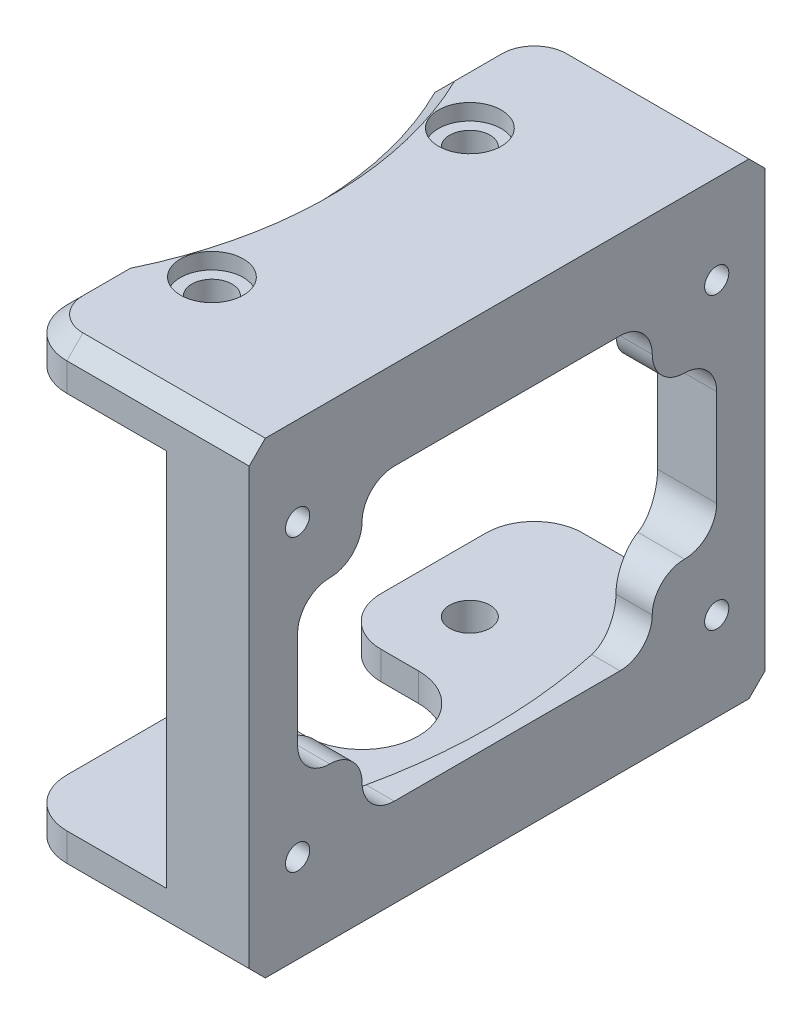
from build123d import *

# Parameters (mm, degrees)
SKETCH_1_W          = 14.314561435
SKETCH_1_H          = 32
SKETCH_1_R          = 1.25
EXTRUDE_1_DEPTH     = 14.5
SKETCH_2_R          = 33
CUT_EXTRUDE_1_DEPTH = 11.75
SKETCH_3_R          = 0.75
CUT_EXTRUDE_2_DEPTH = 26.906691589
CUT_EXTRUDE_3_REACH = 49.466
SKETCH_4_R          = 3.5
CUT_EXTRUDE_5_REACH = 49.466
SKETCH_6_R          = 22
FILLET_1_R          = 3
FILLET_3_R          = 2
CHAMFER_2_SIZE      = 1
SKETCH_5_R          = 1.95
CUT_EXTRUDE_4_DEPTH = 1


with BuildPart() as part:
    # Эскиз1 → Бобышка-Вытянуть1 (new, symmetric)
    with BuildSketch(Plane(origin=(0, 0, 0), x_dir=(1, 0, 0), z_dir=(0, 1, 0))):
        with Locations((26.842719282, 0)):
            Rectangle(SKETCH_1_W, SKETCH_1_H)
        with Locations(Location((23.685438565, 8, 0), (0, 0, 90))):
            Circle(SKETCH_1_R, mode=Mode.SUBTRACT)
        with Locations(Location((23.685438565, -8, 0), (0, 0, 90))):
            Circle(SKETCH_1_R, mode=Mode.SUBTRACT)
    extrude(amount=EXTRUDE_1_DEPTH, both=True)

    # Эскиз2 → Вырез-Вытянуть1 (cut, symmetric)
    with BuildSketch(Plane(origin=(0, 0, 0), x_dir=(1, 0, 0), z_dir=(0, 1, 0))):
        Circle(SKETCH_2_R)
    extrude(amount=CUT_EXTRUDE_1_DEPTH, both=True, mode=Mode.SUBTRACT)

    # Эскиз3 → Вырез-Вытянуть2 (cut, through all)
    with BuildSketch(Plane(origin=(34, 0, 0), x_dir=(0, 0, -1), z_dir=(1, 0, 0))):
        with Locations((-13, 9)):
            Circle(SKETCH_3_R)
        with Locations((-13, -9)):
            Circle(SKETCH_3_R)
        with Locations((13, 9)):
            Circle(SKETCH_3_R)
        with Locations((13, -9)):
            Circle(SKETCH_3_R)
        Polygon((-13, 5), (-9, 5), (-9, 9), (9, 9), (9, 5), (13, 5), (13, -5), (9, -5), (9, -9), (-9, -9), (-9, -5), (-13, -5), align=None)
    extrude(amount=-CUT_EXTRUDE_2_DEPTH, mode=Mode.SUBTRACT)

    # Эскиз4 → Вырез-Вытянуть3 (cut, up to next)
    with BuildSketch(Plane.XZ.offset(14.5), mode=Mode.PRIVATE) as cut_extrude_3_sk1:
        with BuildLine():
            ThreePointArc((25, -3.5), (21.5, 0), (25, 3.5))
            Line((25, 3.5), (19.685438565, 3.5))
            Line((19.685438565, 3.5), (19.685438565, -3.5))
            Line((19.685438565, -3.5), (25, -3.5))
        make_face()
    cut_extrude_3_tool1 = extrude(cut_extrude_3_sk1.sketch, amount=-CUT_EXTRUDE_3_REACH, mode=Mode.PRIVATE) & part.part
    # Эскиз4 → Вырез-Вытянуть3 (cut, up to next)
    with BuildSketch(Plane.XZ.offset(14.5), mode=Mode.PRIVATE) as cut_extrude_3_sk2:
        with Locations((25, 0)):
            Circle(SKETCH_4_R)
    cut_extrude_3_tool2 = extrude(cut_extrude_3_sk2.sketch, amount=-CUT_EXTRUDE_3_REACH, mode=Mode.PRIVATE) & part.part
    add(cut_extrude_3_tool1.solids().sort_by_distance((21.087199, -14.5, 0))[0], mode=Mode.SUBTRACT)
    add(cut_extrude_3_tool2.solids().sort_by_distance((25, -14.5, 0))[0], mode=Mode.SUBTRACT)

    # Эскиз6 → Вырез-Вытянуть5 (cut, up to next)
    with BuildSketch(Plane(origin=(0, 14.5, 0), x_dir=(1, 0, 0), z_dir=(0, 1, 0)), mode=Mode.PRIVATE) as cut_extrude_5_sk1:
        Circle(SKETCH_6_R)
    cut_extrude_5_tool1 = extrude(cut_extrude_5_sk1.sketch, amount=-CUT_EXTRUDE_5_REACH, mode=Mode.PRIVATE) & part.part
    add(cut_extrude_5_tool1.solids().sort_by_distance((0, 14.5, 0))[0], mode=Mode.SUBTRACT)

    # Скругление1
    fillet_1_edges = [part.edges().sort_by_distance(p)[0] for p in [
        (19.685438565, -13.125, -3.5),
        (19.685438565, -13.125, 3.5),
        (19.685438565, -13.125, 16),
        (19.685438565, -13.125, -16),
        (19.685438565, 13.125, 16),
        (19.685438565, 13.125, -16),
    ]]
    fillet(fillet_1_edges, radius=FILLET_1_R)

    # Скругление3
    fillet_3_edges = [part.edges().sort_by_distance(p)[0] for p in [
        (32.165750888, -5, 13),
        (32.874507866, -9, 9),
        (32.874507866, -9, -9),
        (32.165750888, -5, -13),
        (32.165750888, 5, -13),
        (32.874507866, 9, -9),
        (32.165750888, 5, 13),
        (32.874507866, 9, 9),
    ]]
    fillet(fillet_3_edges, radius=FILLET_3_R)
    fillet_3_2_edges = [part.edges().sort_by_distance(p)[0] for p in [
        (32.874507866, -5, 9),
        (32.874507866, -5, -9),
        (32.874507866, 5, -9),
        (32.874507866, 5, 9),
    ]]
    fillet(fillet_3_2_edges, radius=FILLET_3_R - 0.0001)  # a hair under: the kernel refuses the full size

    # Фаска2
    chamfer_2_edges = [part.edges().sort_by_distance(p)[0] for p in [
        (23.842719282, -14.5, -3.5),
        (28.5, -14.5, 0),
        (23.842719282, -14.5, 3.5),
        (19.685438565, 14.5, 11.411300961),
        (22, 14.5, 0),
        (19.685438565, -14.5, 9.75),
        (19.685438565, -14.5, -9.75),
        (28.342719282, -14.5, 16),
        (20.564118221, -14.5, 15.121320344),
        (20.564118221, -14.5, -15.121320344),
        (20.564118221, -14.5, -4.378679656),
        (20.564118221, -14.5, 4.378679656),
        (19.685438565, 14.5, -11.411300961),
        (28.342719282, 14.5, 16),
        (20.564118221, 14.5, 15.121320344),
        (20.564118221, 14.5, -15.121320344),
        (28.342719282, -14.5, -16),
        (28.342719282, 14.5, -16),
    ]]
    chamfer(chamfer_2_edges, length=CHAMFER_2_SIZE)

    # Эскиз5 → Вырез-Вытянуть4 (cut)
    with BuildSketch(Plane(origin=(0, 14.5, 0), x_dir=(1, 0, 0), z_dir=(0, 1, 0))):
        with Locations(Location((23.685438565, 8, 0), (0, 0, 270))):
            Circle(SKETCH_5_R)
        with Locations(Location((23.685438565, -8, 0), (0, 0, 270))):
            Circle(SKETCH_5_R)
    cut_extrude_4 = extrude(amount=-CUT_EXTRUDE_4_DEPTH, mode=Mode.SUBTRACT)

    # Зеркальное отражение1: Вырез-Вытянуть4 across plane
    add(cut_extrude_4.mirror(Plane.ZX), mode=Mode.SUBTRACT)


solid = part.part
